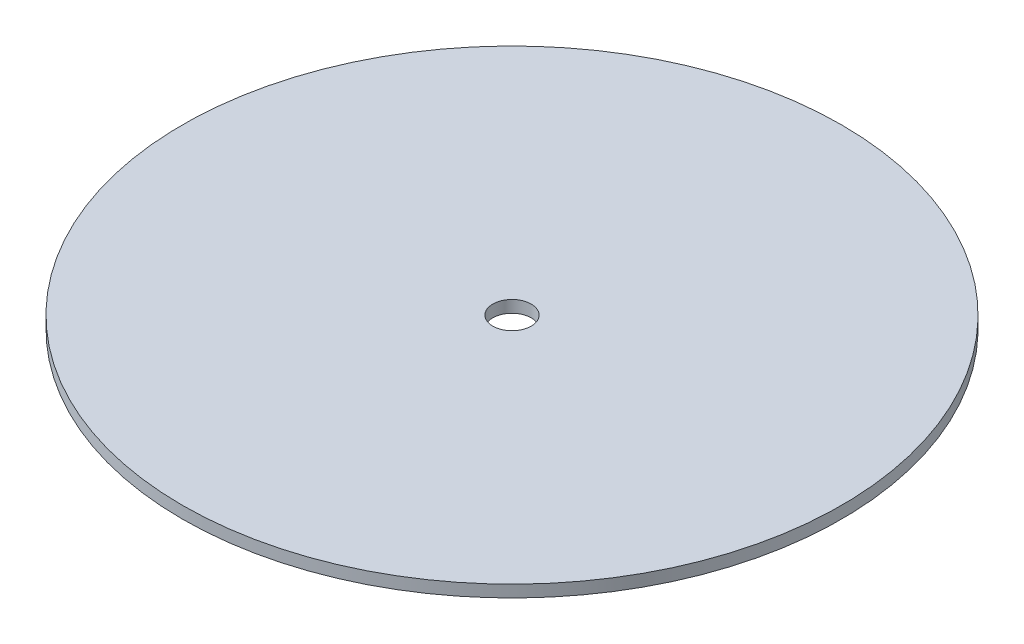
from build123d import *

# Parameters (mm, degrees)
SKETCH1_R           = 137.5
BOSS_EXTRUDE1_DEPTH = 5
SKETCH2_R           = 8
CUT_EXTRUDE1_DEPTH  = 195.518636639


with BuildPart() as part:
    # Sketch1 → Boss-Extrude1 (new body)
    with BuildSketch(Plane(origin=(0, 0, 0), x_dir=(1, 0, 0), z_dir=(0, 1, 0))):
        Circle(SKETCH1_R)
    extrude(amount=BOSS_EXTRUDE1_DEPTH)

    # Sketch2 → Cut-Extrude1 (cut, through all)
    with BuildSketch(Plane(origin=(0, 5, 0), x_dir=(1, 0, 0), z_dir=(0, 1, 0))):
        Circle(SKETCH2_R)
    extrude(amount=-CUT_EXTRUDE1_DEPTH, mode=Mode.SUBTRACT)


solid = part.part
